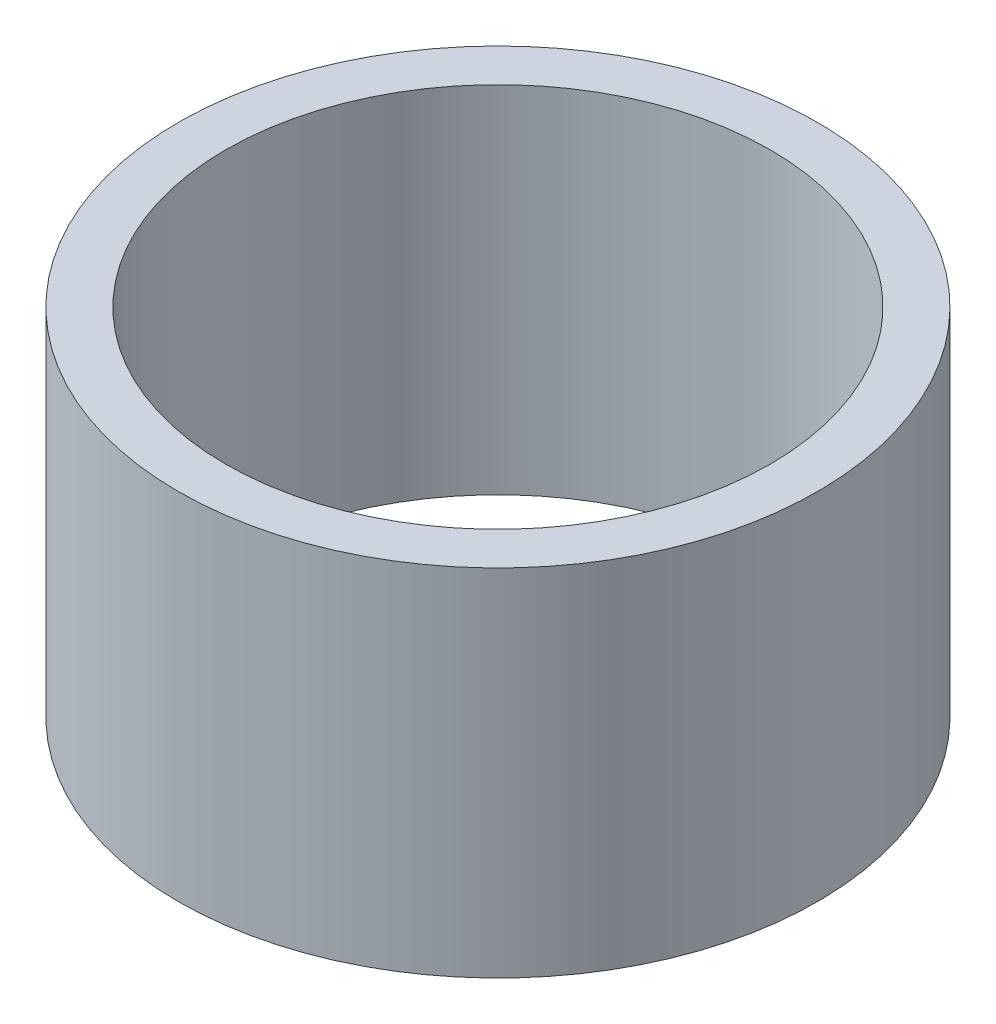
from build123d import *

# Parameters (mm, degrees)
SKETCH1_R           = 1.35
BOSS_EXTRUDE1_DEPTH = 1.5
SKETCH2_R           = 1.15
CUT_EXTRUDE1_DEPTH  = 3.427962108


with BuildPart() as part:
    # Sketch1 → Boss-Extrude1 (new body)
    with BuildSketch(Plane(origin=(0, 0, 0), x_dir=(1, 0, 0), z_dir=(0, 1, 0))):
        Circle(SKETCH1_R)
    extrude(amount=BOSS_EXTRUDE1_DEPTH)

    # Sketch2 → Cut-Extrude1 (cut, through all)
    with BuildSketch(Plane(origin=(0, 1.5, 0), x_dir=(1, 0, 0), z_dir=(0, 1, 0))):
        Circle(SKETCH2_R)
    extrude(amount=-CUT_EXTRUDE1_DEPTH, mode=Mode.SUBTRACT)


solid = part.part
